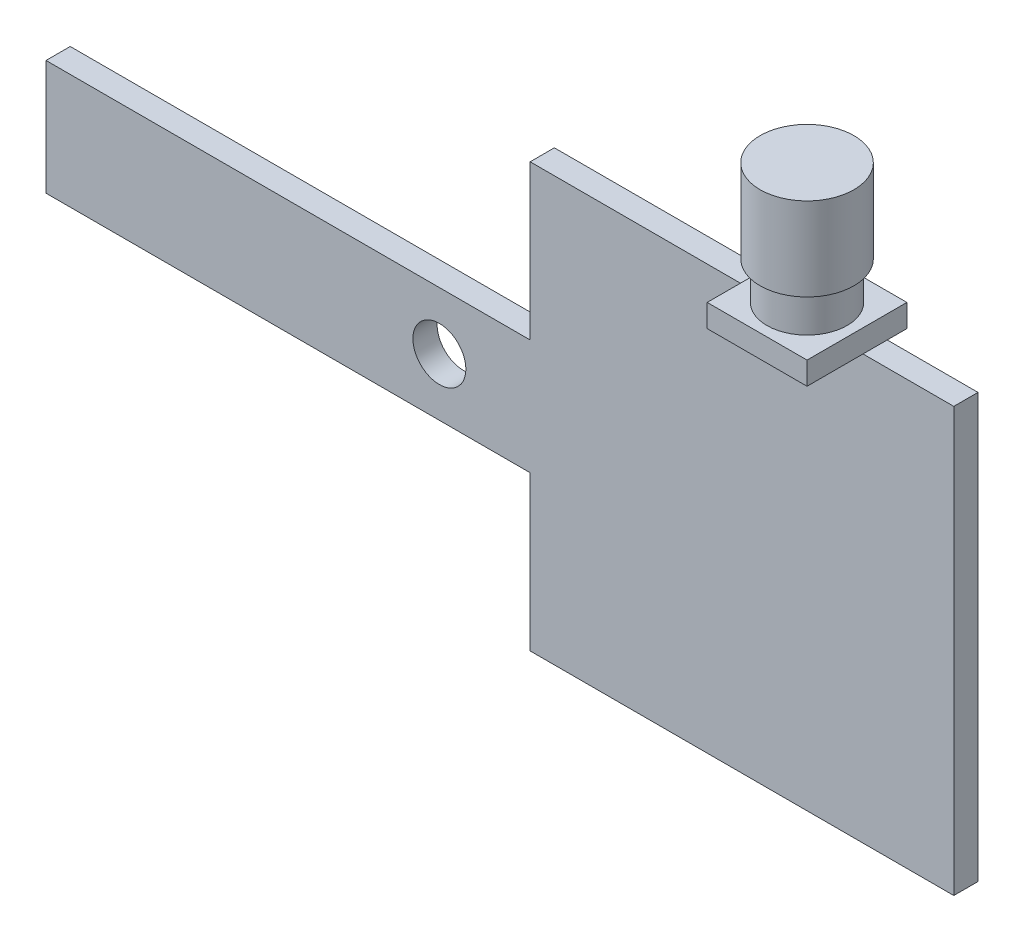
from build123d import *

# Parameters (mm, degrees)
SKETCH1_R           = 1.75
BOSS_EXTRUDE1_DEPTH = 1.6
SKETCH2_W           = 6.6
SKETCH2_H           = 6.6
BOSS_EXTRUDE2_DEPTH = 1.5
SKETCH3_R           = 2.65
BOSS_EXTRUDE3_DEPTH = 2.5
SKETCH4_R           = 3.1
BOSS_EXTRUDE4_DEPTH = 5.5


with BuildPart() as part:
    # Sketch1 → Boss-Extrude1 (new body)
    with BuildSketch(Plane.XY):
        Polygon((28, 14), (0, 14), (0, 3.8), (-32, 3.8), (-32, -3.8), (0, -3.8), (0, -14), (28, -14), align=None)
        with Locations((-6, 0)):
            Circle(SKETCH1_R, mode=Mode.SUBTRACT)
    extrude(amount=BOSS_EXTRUDE1_DEPTH)


with BuildPart() as body_2:
    # Sketch2 → Boss-Extrude2 (new body)
    with BuildSketch(Plane(origin=(0, 14, 0), x_dir=(1, 0, 0), z_dir=(0, 1, 0))):
        with Locations((18.7, -2)):
            Rectangle(SKETCH2_W, SKETCH2_H)
    extrude(amount=BOSS_EXTRUDE2_DEPTH)

    # Sketch3 → Boss-Extrude3 (add)
    with BuildSketch(Plane(origin=(0, 15.5, 0), x_dir=(1, 0, 0), z_dir=(0, 1, 0))):
        with Locations((18.7, -2)):
            Circle(SKETCH3_R)
    extrude(amount=BOSS_EXTRUDE3_DEPTH)

    # Sketch4 → Boss-Extrude4 (add)
    with BuildSketch(Plane(origin=(0, 18, 0), x_dir=(1, 0, 0), z_dir=(0, 1, 0))):
        with Locations((18.7, -2)):
            Circle(SKETCH4_R)
    extrude(amount=BOSS_EXTRUDE4_DEPTH)


solid = Compound([part.part, body_2.part])
